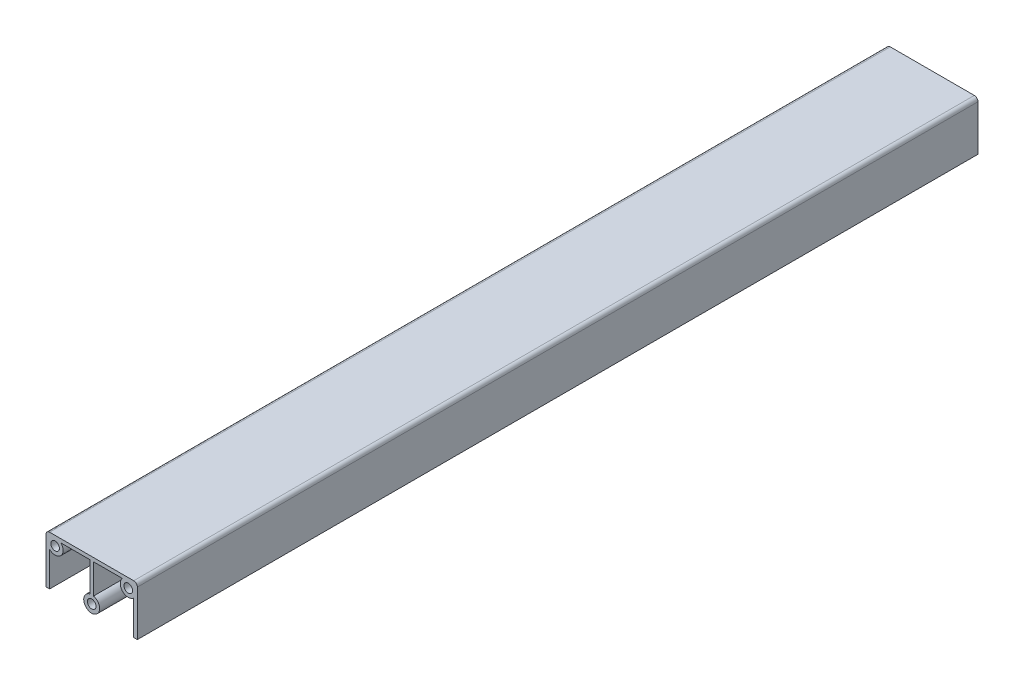
from build123d import *

# Parameters (mm, degrees)
SKETCH1_W           = 63.5
SKETCH1_H           = 63.5
SKETCH1_R           = 3
BOSS_EXTRUDE1_DEPTH = 292.1
FILLET1_R           = 2.54
SKETCH7_R           = 3
CUT_EXTRUDE3_DEPTH  = 586.923002621
SKETCH3_W           = 63.665273771
SKETCH3_H           = 29.464
CUT_EXTRUDE2_DEPTH  = 586.923002621


with BuildPart() as part:
    # Sketch1 → Boss-Extrude1 (new, symmetric)
    with BuildSketch(Plane.XY):
        Rectangle(SKETCH1_W, SKETCH1_H)
        with Locations((-25.4, 25.4)):
            Circle(SKETCH1_R, mode=Mode.SUBTRACT)
        with Locations((25.4, -25.4)):
            Circle(SKETCH1_R, mode=Mode.SUBTRACT)
        with Locations((-25.4, -25.4)):
            Circle(SKETCH1_R, mode=Mode.SUBTRACT)
        with Locations((25.4, 25.4)):
            Circle(SKETCH1_R, mode=Mode.SUBTRACT)
    extrude(amount=BOSS_EXTRUDE1_DEPTH, both=True)

    # Fillet1
    fillet1_edges = [part.edges().sort_by_distance(p)[0] for p in [
        (-31.75, -31.75, 0),
        (31.75, -31.75, 0),
        (-31.75, 31.75, 0),
        (31.75, 31.75, 0),
    ]]
    fillet(fillet1_edges, radius=FILLET1_R)

    # Sketch7 → Cut-Extrude3 (cut, through all)
    with BuildSketch(Plane.XY.offset(292.1)):
        with Locations((0, 3.175)):
            Circle(SKETCH7_R)
        with BuildLine():
            Line((1.27, -2.217466968), (1.27, -29.21))
            Line((1.27, -29.21), (21.378122329, -29.21))
            ThreePointArc((21.378122329, -29.21), (21.482628432, -21.482628432), (29.21, -21.378122329))
            Line((29.21, -21.378122329), (29.21, 21.378122329))
            ThreePointArc((29.21, 21.378122329), (21.482628432, 21.482628432), (21.378122329, 29.21))
            Line((21.378122329, 29.21), (1.27, 29.21))
            Line((1.27, 29.21), (1.27, 8.567466968))
            ThreePointArc((1.27, 8.567466968), (5.54, 3.175), (1.27, -2.217466968))
        make_face()
        with BuildLine():
            Line((-1.27, -2.217466968), (-1.27, -29.21))
            Line((-1.27, -29.21), (-21.378122329, -29.21))
            ThreePointArc((-21.378122329, -29.21), (-21.482628432, -21.482628432), (-29.21, -21.378122329))
            Line((-29.21, -21.378122329), (-29.21, 21.378122329))
            ThreePointArc((-29.21, 21.378122329), (-21.482628432, 21.482628432), (-21.378122329, 29.21))
            Line((-21.378122329, 29.21), (-1.27, 29.21))
            Line((-1.27, 29.21), (-1.27, 8.567466968))
            ThreePointArc((-1.27, 8.567466968), (-5.54, 3.175), (-1.27, -2.217466968))
        make_face()
    extrude(amount=-CUT_EXTRUDE3_DEPTH, mode=Mode.SUBTRACT)

    # Sketch3 → Cut-Extrude2 (cut, through all)
    with BuildSketch(Plane.XY.offset(292.1)):
        with Locations((0.082636885, -17.146852467)):
            Rectangle(SKETCH3_W, SKETCH3_H)
    extrude(amount=-CUT_EXTRUDE2_DEPTH, mode=Mode.SUBTRACT)


solid = part.part
